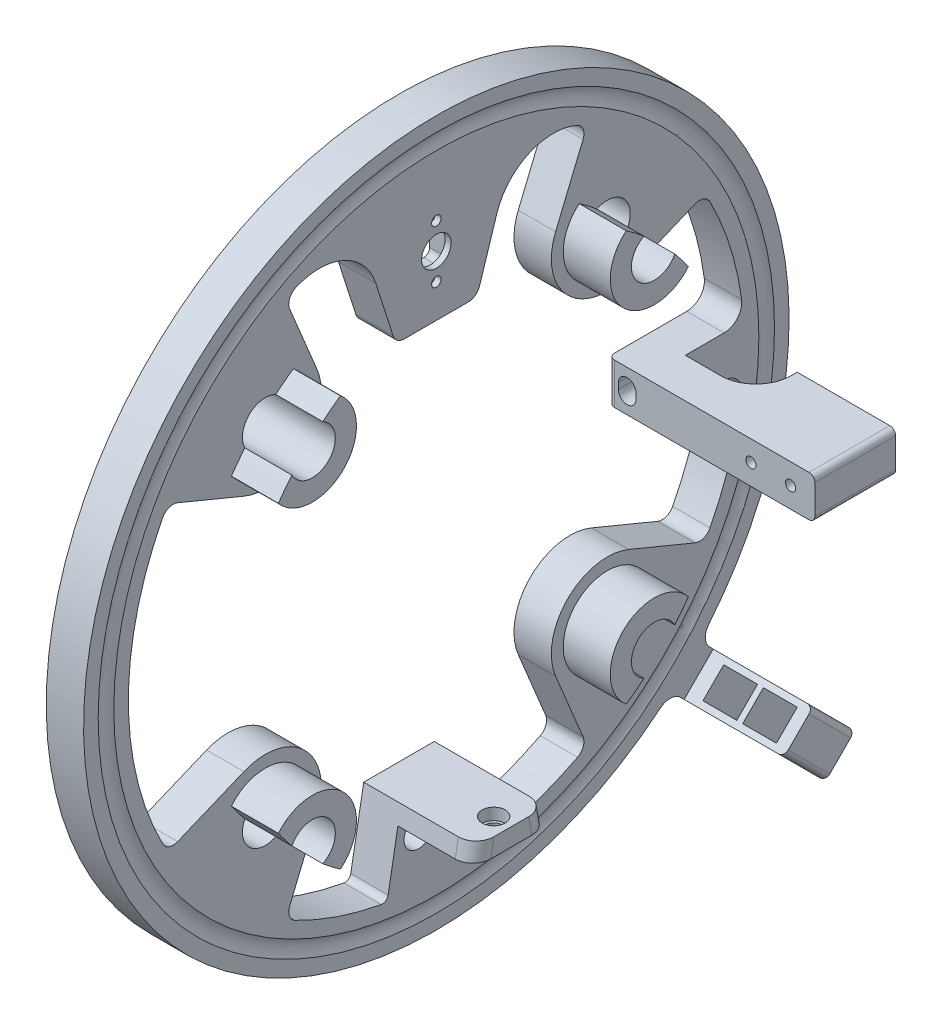
from build123d import *

# Parameters (mm, degrees)
SKETCH1_R                = 60
SKETCH1_R_2              = 52.38
BOSS_EXTRUDE1_DEPTH      = 6.35
BOSS_EXTRUDE2_DEPTH      = 6.35
SKETCH3_R                = 7.5
BOSS_EXTRUDE3_DEPTH      = 8
SKETCH4_R                = 3.9
CUT_EXTRUDE2_DEPTH       = 87.057669618
FILLET5_R                = 2
CIRPATTERN1_COUNT        = 4
FILLET5_OF_CIRPATTERN1_R = 2
SKETCH5_R                = 2.5
SKETCH5_R_2              = 0.8
BOSS_EXTRUDE5_DEPTH      = 6.35
SKETCH6_W                = 10.4
SKETCH6_H                = 12.4
CUT_EXTRUDE1_DEPTH       = 5.35
FILLET1_R                = 1
FILLET2_R                = 10.08
FILLET3_R                = 2
SKETCH14_W               = 24.267829677
SKETCH14_H               = 7
BOSS_EXTRUDE8_DEPTH      = 6.35
FILLET7_R                = 3
SKETCH7_R                = 2.645
BOSS_EXTRUDE6_DEPTH      = 6.35
FILLET6_R                = 2.54
BOSS_EXTRUDE7_DEPTH      = 17
SKETCH11_W               = 5.75
SKETCH11_H               = 5
CUT_EXTRUDE3_DEPTH       = 8.5
SKETCH12_R               = 0.875
CUT_EXTRUDE4_DEPTH       = 159.183521033
SKETCH15_W               = 13.75
SKETCH15_H               = 7
BOSS_EXTRUDE9_DEPTH      = 28.75
SKETCH16_W               = 5.75
SKETCH16_H               = 5
CUT_EXTRUDE5_DEPTH       = 12.25
SKETCH17_R               = 0.875
CUT_EXTRUDE6_DEPTH       = 120.441395253
FILLET8_R                = 1
CUT_EXTRUDE7_DEPTH       = 92.825976717
SKETCH19_R               = 2.5
BOSS_EXTRUDE10_DEPTH     = 6.35
FILLET9_R                = 1
CUT_EXTRUDE8_DEPTH       = 4
CUT_EXTRUDE8_DEPTH_BACK  = 8
SKETCH20_R               = 60
SKETCH20_R_2             = 42.5
FILLET10_R               = 6
BOSS_EXTRUDE11_DEPTH     = 12.75
FILLET11_R               = 3
SKETCH24_R               = 1.95
CUT_EXTRUDE9_DEPTH       = 2
SKETCH25_R               = 1.5
CUT_EXTRUDE10_DEPTH      = 1


with BuildPart() as part:
    # Sketch1 → Boss-Extrude1 (new body)
    with BuildSketch(Plane(origin=(0, 0, 0), x_dir=(0, 0, -1), z_dir=(1, 0, 0))):
        Circle(SKETCH1_R)
        Circle(SKETCH1_R_2, mode=Mode.SUBTRACT)
    extrude(amount=BOSS_EXTRUDE1_DEPTH)

    # Sketch2 → Boss-Extrude2 (add)
    with BuildSketch(Plane.ZY):
        with BuildLine():
            Line((-20.283349363, 32.728361603), (-28.579201197, 52.756319612))
            Line((-28.579201197, 52.756319612), (-52.756319612, 28.579201197))
            Line((-52.756319612, 28.579201197), (-32.728361603, 20.283349363))
            ThreePointArc((-32.728361603, 20.283349363), (-22.348109819, 22.348109819), (-20.283349363, 32.728361603))
        make_face()
    boss_extrude2 = extrude(amount=-BOSS_EXTRUDE2_DEPTH)

    # Sketch3 → Boss-Extrude3 (add)
    with BuildSketch(Plane(origin=(6.35, 0, 0), x_dir=(0, 0, -1), z_dir=(1, 0, 0))):
        with Locations((29.08330191, 29.08330191)):
            Circle(SKETCH3_R)
    boss_extrude3 = extrude(amount=BOSS_EXTRUDE3_DEPTH)

    # Sketch4 → Cut-Extrude2 (cut, through all)
    with BuildSketch(Plane(origin=(14.35, 0, 0), x_dir=(0, 0, -1), z_dir=(1, 0, 0))):
        with Locations((29.08330191, 29.08330191)):
            Circle(SKETCH4_R)
    cut_extrude2 = extrude(amount=-CUT_EXTRUDE2_DEPTH, mode=Mode.SUBTRACT)

    # Fillet5
    fillet5_edges = [part.edges().sort_by_distance(p)[0] for p in [
        (3.175, 25.64506718, -45.672693476),
        (3.175, 45.672693476, -25.64506718),
    ]]
    fillet(fillet5_edges, radius=FILLET5_R)

    # CirPattern1: Boss-Extrude2, Boss-Extrude3, Cut-Extrude2 ×4 about axis
    cirpattern1_axis = Axis((0, 0, 0), (1, 0, 0))
    add([boss_extrude2.rotate(cirpattern1_axis, i * 360 / CIRPATTERN1_COUNT) for i in range(1, CIRPATTERN1_COUNT)])
    add([boss_extrude3.rotate(cirpattern1_axis, i * 360 / CIRPATTERN1_COUNT) for i in range(1, CIRPATTERN1_COUNT)])
    add([cut_extrude2.rotate(cirpattern1_axis, i * 360 / CIRPATTERN1_COUNT) for i in range(1, CIRPATTERN1_COUNT)], mode=Mode.SUBTRACT)

    # Fillet5 of CirPattern1
    fillet5_of_cirpattern1_edges = [part.edges().sort_by_distance(p)[0] for p in [
        (3.175, 45.672693476, 25.64506718),
        (3.175, 25.64506718, 45.672693476),
        (3.175, -25.64506718, 45.672693476),
        (3.175, -45.672693476, 25.64506718),
        (3.175, -45.672693476, -25.64506718),
        (3.175, -25.64506718, -45.672693476),
    ]]
    fillet(fillet5_of_cirpattern1_edges, radius=FILLET5_OF_CIRPATTERN1_R)

    # Sketch5 → Boss-Extrude5 (add)
    with BuildSketch(Plane.ZY):
        Polygon((15.871031945, 57.862858078), (-15.871031945, 57.862858078), (-6.902803858, 29.806267599), (6.902803858, 29.806267599), align=None)
        with Locations((0, 40)):
            Circle(SKETCH5_R, mode=Mode.SUBTRACT)
        with Locations((0, 35.5)):
            Circle(SKETCH5_R_2, mode=Mode.SUBTRACT)
        with Locations((0, 44.5)):
            Circle(SKETCH5_R_2, mode=Mode.SUBTRACT)
    extrude(amount=-BOSS_EXTRUDE5_DEPTH)

    # Sketch6 → Cut-Extrude1 (cut)
    with BuildSketch(Plane.ZY):
        with Locations((0, 40)):
            Rectangle(SKETCH6_W, SKETCH6_H)
    extrude(amount=-CUT_EXTRUDE1_DEPTH, mode=Mode.SUBTRACT)

    # Fillet1
    fillet1_edges = [part.edges().sort_by_distance(p)[0] for p in [
        (2.675, 33.8, 5.2),
        (2.675, 46.2, 5.2),
        (2.675, 46.2, -5.2),
        (2.675, 33.8, -5.2),
    ]]
    fillet(fillet1_edges, radius=FILLET1_R)

    # Fillet2
    # the kernel refuses this fillet: 10.08 mm, written as the material it adds along each edge
    with BuildSketch(Plane(origin=(6.35, 50.597415992, -13.548649194), x_dir=(0, -0.3607258512684061, -0.9326718931257036), z_dir=(-1, 0, 0))) as fillet2_piece_1:
        with BuildLine():
            CenterArc((10.699243054, 10.065979832), FILLET2_R, 176.581586135, 96.440691258)
            Line((0.637178233, 10.667021881), (0, 0))
            ThreePointArc((0, 0), (5.615351663, -0.301864226), (11.230703326, 0))
        make_face()
    extrude(amount=6.35)
    with BuildSketch(Plane(origin=(6.35, 50.597415992, 13.548649194), x_dir=(0, -0.9525214731914663, -0.3044714159147929), z_dir=(-1, 0, 0))) as fillet2_piece_2:
        with BuildLine():
            CenterArc((10.686035369, 10.08), FILLET2_R, 173.559308742, 96.440691258)
            ThreePointArc((0.669655252, 11.210720719), (0.033500502, 5.623359674), (0, 0))
            Line((0, 0), (10.686035369, 0))
        make_face()
    extrude(amount=6.35)

    # Fillet3
    fillet3_edges = [part.edges().sort_by_distance(p)[0] for p in [
        (3.175, 29.806267599, 6.902803858),
        (3.175, 29.806267599, -6.902803858),
    ]]
    fillet(fillet3_edges, radius=FILLET3_R)

    # Sketch14 → Boss-Extrude8 (add)
    with BuildSketch(Plane.ZY):
        with Locations((-47.763914838, 0)):
            Rectangle(SKETCH14_W, SKETCH14_H)
    extrude(amount=-BOSS_EXTRUDE8_DEPTH)

    # Fillet7
    fillet7_edges = [part.edges().sort_by_distance(p)[0] for p in [
        (3.175, -3.5, -52.262935241),
        (3.175, 3.5, -52.262935241),
    ]]
    fillet(fillet7_edges, radius=FILLET7_R)

    # Sketch7 → Cut-Revolve1 (revolve, cut)
    with BuildSketch(Plane(origin=(0, 0, 0), x_dir=(1, 0, 0), z_dir=(0, 1, 0))):
        with Locations((8.636, 56.19)):
            Circle(SKETCH7_R)
        with Locations((-2.286, 56.19)):
            Circle(SKETCH7_R)
    revolve(axis=Axis((6.35, 0, 0), (-1, 0, 0)), mode=Mode.SUBTRACT)

    # Sketch9 → Boss-Extrude6 (add)
    with BuildSketch(Plane.ZY):
        Polygon((-54.162844789, -49.21309732), (-49.21309732, -54.162844789), (-39.879287809, -44.829035277), (-44.829035277, -39.879287809), align=None)
    extrude(amount=-BOSS_EXTRUDE6_DEPTH)

    # Fillet6
    fillet6_edges = [part.edges().sort_by_distance(p)[0] for p in [
        (3.175, -44.829035277, -39.879287809),
        (3.175, -39.879287809, -44.829035277),
    ]]
    fillet(fillet6_edges, radius=FILLET6_R)

    # Sketch10 → Boss-Extrude7 (add)
    with BuildSketch(Plane(origin=(6.35, 0, 0), x_dir=(0, 0, -1), z_dir=(1, 0, 0))):
        Polygon((49.21309732, -54.162844789), (54.162844789, -49.21309732), (47.091776977, -42.142029509), (42.142029509, -47.091776977), align=None)
    extrude(amount=BOSS_EXTRUDE7_DEPTH)

    # Sketch11 → Cut-Extrude3 (cut)
    with BuildSketch(Plane(origin=(0, -44.616903243, -44.616903243), x_dir=(1, 0, 0), z_dir=(0, 0.7071067811865477, 0.7071067811865475))):
        with Locations((11.725, 0)):
            Rectangle(SKETCH11_W, SKETCH11_H)
        with Locations((18.475, 0)):
            Rectangle(SKETCH11_W, SKETCH11_H)
    extrude(amount=-CUT_EXTRUDE3_DEPTH, mode=Mode.SUBTRACT)

    # Sketch12 → Cut-Extrude4 (cut, through all)
    with BuildSketch(Plane(origin=(0, -50.627310883, -50.627310883), x_dir=(1, 0, 0), z_dir=(0, 0.7071067811865477, 0.7071067811865475))):
        with Locations(Location((11.725, 0, 0), (0, 0, 270))):
            Circle(SKETCH12_R)
        with Locations(Location((18.475, 0, 0), (0, 0, 270))):
            Circle(SKETCH12_R)
    extrude(amount=-CUT_EXTRUDE4_DEPTH, mode=Mode.SUBTRACT)

    # Sketch15 → Boss-Extrude9 (add)
    with BuildSketch(Plane(origin=(6.35, 0, 0), x_dir=(0, 0, -1), z_dir=(1, 0, 0))):
        with Locations((42.505, 0)):
            Rectangle(SKETCH15_W, SKETCH15_H)
    extrude(amount=BOSS_EXTRUDE9_DEPTH)

    # Sketch16 → Cut-Extrude5 (cut)
    with BuildSketch(Plane(origin=(0, 0, -49.38), x_dir=(-1, 0, 0), z_dir=(0, 0, -1))):
        with Locations((-30.975, 0)):
            Rectangle(SKETCH16_W, SKETCH16_H)
        with Locations((-24.225, 0)):
            Rectangle(SKETCH16_W, SKETCH16_H)
    extrude(amount=-CUT_EXTRUDE5_DEPTH, mode=Mode.SUBTRACT)

    # Sketch17 → Cut-Extrude6 (cut, through all)
    with BuildSketch(Plane(origin=(0, 0, -37.13), x_dir=(-1, 0, 0), z_dir=(0, 0, -1))):
        with Locations((-30.975, 0)):
            Circle(SKETCH17_R)
        with Locations((-24.225, 0)):
            Circle(SKETCH17_R)
    extrude(amount=-CUT_EXTRUDE6_DEPTH, mode=Mode.SUBTRACT)

    # Fillet8
    fillet8_edges = [part.edges().sort_by_distance(p)[0] for p in [
        (0, 0, -35.63),
        (0, -51.687971055, -51.687971055),
        (23.35, -50.627310883, -45.677563414),
        (23.35, -45.677563414, -50.627310883),
        (35.1, -3.5, -42.505),
        (35.1, 3.5, -42.505),
    ]]
    fillet(fillet8_edges, radius=FILLET8_R)

    # Sketch18 → Cut-Extrude7 (cut, through all)
    with BuildSketch(Plane.XY):
        with BuildLine():
            Line((1.675, -0.5), (1.675, 0.5))
            ThreePointArc((1.675, 0.5), (3.175, 2), (4.675, 0.5))
            Line((4.675, 0.5), (4.675, -0.5))
            ThreePointArc((4.675, -0.5), (3.175, -2), (1.675, -0.5))
        make_face()
    extrude(amount=-CUT_EXTRUDE7_DEPTH, mode=Mode.SUBTRACT)

    # Sketch19 → Boss-Extrude10 (add)
    with BuildSketch(Plane.ZY):
        Polygon((6, -38.38), (-6, -38.38), (-8.5, -52.38), (8.5, -52.38), align=None)
        with Locations((3, -44)):
            Circle(SKETCH19_R, mode=Mode.SUBTRACT)
        with Locations((-3, -44)):
            Circle(SKETCH19_R, mode=Mode.SUBTRACT)
    extrude(amount=-BOSS_EXTRUDE10_DEPTH)

    # Fillet9
    fillet9_edges = [part.edges().sort_by_distance(p)[0] for p in [
        (3.175, -51.705394286, -8.379534694),
        (3.175, -51.705394286, 8.379534694),
    ]]
    fillet(fillet9_edges, radius=FILLET9_R)

    # Sketch20 → Cut-Extrude8 (cut, two sides: drawn at the far end of the back side and taken through both)
    with BuildSketch(Plane(origin=(14.35, 0, 0), x_dir=(0, 0, -1), z_dir=(1, 0, 0)).offset(-CUT_EXTRUDE8_DEPTH_BACK)):
        Circle(SKETCH20_R)
        Circle(SKETCH20_R_2, mode=Mode.SUBTRACT)
    extrude(amount=CUT_EXTRUDE8_DEPTH + CUT_EXTRUDE8_DEPTH_BACK, mode=Mode.SUBTRACT)

    # Fillet10
    fillet10_edges = [part.edges().sort_by_distance(p)[0] for p in [
        (18.35, 0, -42.5),
    ]]
    fillet(fillet10_edges, radius=FILLET10_R)

    # Sketch23 → Boss-Extrude11 (add)
    with BuildSketch(Plane(origin=(6.35, 0, 0), x_dir=(0, 0, -1), z_dir=(1, 0, 0))):
        Polygon((6, -38.38), (-6, -38.38), (-6.535714286, -41.38), (6.535714286, -41.38), align=None)
    extrude(amount=BOSS_EXTRUDE11_DEPTH)

    # Fillet11
    fillet11_edges = [part.edges().sort_by_distance(p)[0] for p in [
        (19.1, -39.88, -6.267857143),
        (19.1, -39.88, 6.267857143),
    ]]
    fillet(fillet11_edges, radius=FILLET11_R)

    # Sketch24 → Cut-Extrude9 (cut)
    with BuildSketch(Plane(origin=(0, -38.38, 0), x_dir=(1, 0, 0), z_dir=(0, 1, 0))):
        with Locations(Location((16.1, 0, 0), (0, 0, 270))):
            Circle(SKETCH24_R)
    extrude(amount=-CUT_EXTRUDE9_DEPTH, mode=Mode.SUBTRACT)

    # Sketch25 → Cut-Extrude10 (cut)
    with BuildSketch(Plane(origin=(0, -40.38, 0), x_dir=(1, 0, 0), z_dir=(0, 1, 0))):
        with Locations(Location((16.1, 0, 0), (0, 0, 270))):
            Circle(SKETCH25_R)
    extrude(amount=-CUT_EXTRUDE10_DEPTH, mode=Mode.SUBTRACT)


solid = part.part
